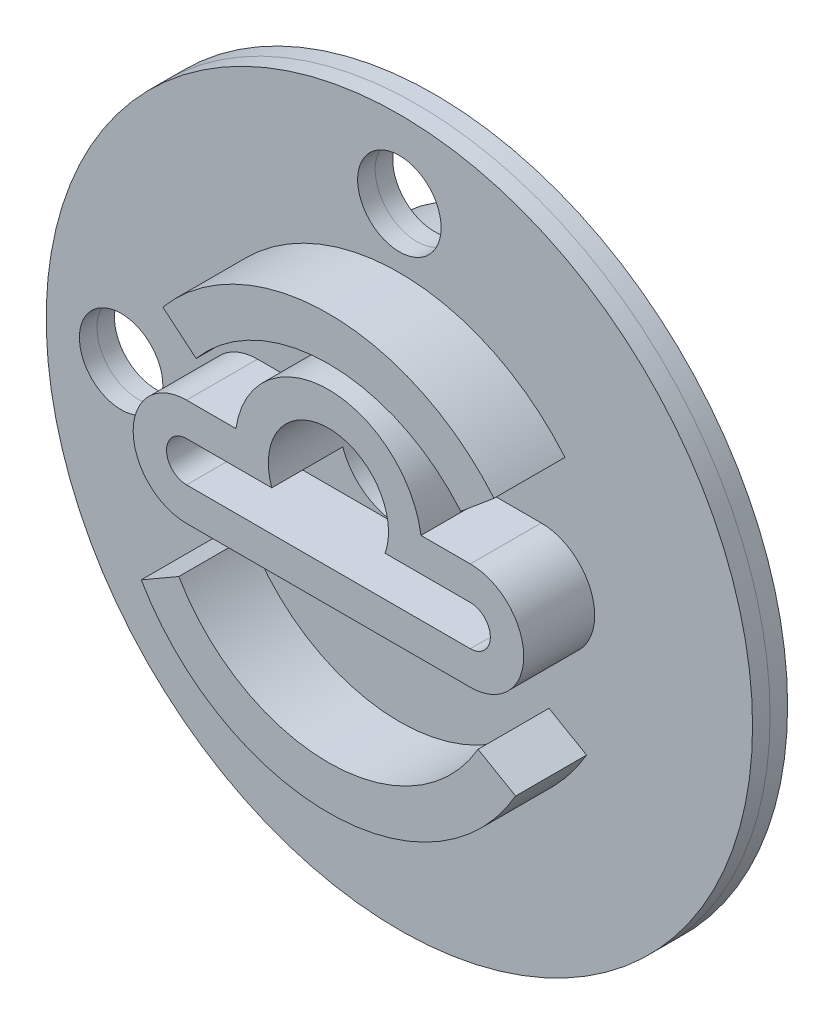
from build123d import *
from build123d.topology import SkipClean

# Parameters (mm, degrees)
SKETCH1_R               = 21.16
BOSS_EXTRUDE2_DEPTH     = 2.1
CUT_EXTRUDE1_DEPTH      = 30.998353288
CUT_EXTRUDE1_DEPTH_BACK = 30.998353288
SKETCH3_R               = 3.6
SKETCH6_R               = 4.85
SKETCH6_R_2             = 3.6
BOSS_EXTRUDE5_DEPTH     = 2.2
SKETCH7_R               = 11.25
SKETCH7_R_2             = 10
BOSS_EXTRUDE6_DEPTH     = 6
SPLIT1_SURFACE_1_BACK   = 61.395
SPLIT1_SURFACE_1_DEPTH  = 122.79
SPLIT1_SURFACE_2_BACK   = 61.395
SPLIT1_SURFACE_2_DEPTH  = 122.79
BOSS_EXTRUDE7_START     = 4.25
BOSS_EXTRUDE7_DEPTH     = 4.25
BOSS_EXTRUDE4_DEPTH     = 4.25
SKETCH10_R              = 2.5
CUT_EXTRUDE2_DEPTH      = 32.001632215


with BuildPart() as part:
    # Sketch1 → Boss-Extrude2 (new body)
    with BuildSketch(Plane.XY):
        Circle(SKETCH1_R)
    extrude(amount=BOSS_EXTRUDE2_DEPTH)

    # Sketch3 → Cut-Extrude1 (cut, two sides: drawn at the far end of the back side and taken through both)
    with BuildSketch(Plane.XY.offset(2.1).offset(-CUT_EXTRUDE1_DEPTH_BACK)):
        with Locations((0, 3.41)):
            Circle(SKETCH3_R)
    extrude(amount=CUT_EXTRUDE1_DEPTH + CUT_EXTRUDE1_DEPTH_BACK, mode=Mode.SUBTRACT)

    # Sketch6 → Boss-Extrude5 (add)
    with SkipClean():  # the faces are left unmerged after this step: merging them gives an invalid solid
        with BuildSketch(Plane(origin=(0, 0, 0), x_dir=(-1, 0, 0), z_dir=(0, 0, -1))):
            with Locations((0, 3.595)):
                Circle(SKETCH6_R)
            with Locations((0, 3.41)):
                Circle(SKETCH6_R_2, mode=Mode.SUBTRACT)
        extrude(amount=BOSS_EXTRUDE5_DEPTH)

    # Sketch7 → Boss-Extrude6 (add)
    with SkipClean():  # the faces are left unmerged after this step: merging them gives an invalid solid
        with BuildSketch(Plane(origin=(0, 0, 0), x_dir=(-1, 0, 0), z_dir=(0, 0, -1))):
            Circle(SKETCH7_R)
            Circle(SKETCH7_R_2, mode=Mode.SUBTRACT)
        extrude(amount=BOSS_EXTRUDE6_DEPTH)


with BuildPart() as body_2:
    # Split1: the piece behind the surface
    add(part.part)
    # Split1 surface: a surface, the sketch's curves swept straight by 122.79 mm
    with BuildLine(Plane(origin=(0, 0, 0), x_dir=(0, 0, -1), z_dir=(1, 0, 0)).offset(-SPLIT1_SURFACE_1_BACK), mode=Mode.PRIVATE) as split1_surface_1_path:
        Line((-1.05, 21.16), (-1.05, -21.16))
    split1_surface_1 = Shell.extrude(split1_surface_1_path.wire(), (1 * SPLIT1_SURFACE_1_DEPTH, 0 * SPLIT1_SURFACE_1_DEPTH, 0 * SPLIT1_SURFACE_1_DEPTH))
    split(bisect_by=split1_surface_1, keep=Keep.BOTTOM)

    # Sketch9 → Boss-Extrude7 (add)
    with BuildSketch(Plane.XY.offset(2.1).offset(BOSS_EXTRUDE7_START)):
        with BuildLine():
            Line((-8.5, -2.19), (8.5, -2.19))
            ThreePointArc((8.5, -2.19), (11.7, 1.01), (8.5, 4.21))
            Line((8.5, 4.21), (5.542562584, 4.21))
            ThreePointArc((5.542562584, 4.21), (0, 9.01), (-5.542562584, 4.21))
            Line((-5.542562584, 4.21), (-8.5, 4.21))
            ThreePointArc((-8.5, 4.21), (-11.7, 1.01), (-8.5, -2.19))
        make_face()
        with BuildLine():
            Line((-8.5, -0.19), (8.5, -0.19))
            ThreePointArc((8.5, -0.19), (9.7, 1.01), (8.5, 2.21))
            Line((8.5, 2.21), (3.39411255, 2.21))
            ThreePointArc((3.39411255, 2.21), (0, 7.01), (-3.39411255, 2.21))
            Line((-3.39411255, 2.21), (-8.5, 2.21))
            ThreePointArc((-8.5, 2.21), (-9.7, 1.01), (-8.5, -0.19))
        make_face(mode=Mode.SUBTRACT)
    extrude(amount=-BOSS_EXTRUDE7_DEPTH)

    # Sketch5 → Boss-Extrude4 (add)
    with BuildSketch(Plane.XY.offset(2.1)):
        with BuildLine():
            Line((7.928559986, 6.65285176), (9.920275538, 8.324099545))
            ThreePointArc((9.920275538, 8.324099545), (0, 12.95), (-9.920275538, 8.324099545))
            Line((-9.920275538, 8.324099545), (-7.928559986, 6.65285176))
            ThreePointArc((-7.928559986, 6.65285176), (0, 10.35), (7.928559986, 6.65285176))
        make_face()
        with BuildLine():
            Line((-8.963362929, -5.175), (-11.215028979, -6.475))
            ThreePointArc((-11.215028979, -6.475), (0, -12.95), (11.215028979, -6.475))
            Line((11.215028979, -6.475), (8.963362929, -5.175))
            ThreePointArc((8.963362929, -5.175), (0, -10.35), (-8.963362929, -5.175))
        make_face()
    extrude(amount=BOSS_EXTRUDE4_DEPTH)


with BuildPart() as part_1:
    add(part.part)

    # Split1: split by a surface, the side it looks to stays
    # Split1 surface: a surface, the sketch's curves swept straight by 122.79 mm
    with BuildLine(Plane(origin=(0, 0, 0), x_dir=(0, 0, -1), z_dir=(1, 0, 0)).offset(-SPLIT1_SURFACE_2_BACK), mode=Mode.PRIVATE) as split1_surface_2_path:
        Line((-1.05, 21.16), (-1.05, -21.16))
    split1_surface_2 = Shell.extrude(split1_surface_2_path.wire(), (1 * SPLIT1_SURFACE_2_DEPTH, 0 * SPLIT1_SURFACE_2_DEPTH, 0 * SPLIT1_SURFACE_2_DEPTH))
    split(bisect_by=split1_surface_2, keep=Keep.TOP)


with BuildPart() as cut_extrude2_tool:
    # Sketch10 → Cut-Extrude2 (new, through all)
    with SkipClean():  # the faces are left unmerged after this step: merging them gives an invalid solid
        with BuildSketch(Plane.XY.offset(2.1)):
            with Locations((0, 16.527610664)):
                Circle(SKETCH10_R)
            with Locations((-16.670494114, 0)):
                Circle(SKETCH10_R)
        extrude(amount=-CUT_EXTRUDE2_DEPTH)


with BuildPart() as part_2:
    with SkipClean():  # the faces are left unmerged after this step: merging them gives an invalid solid
        add(part_1.part)

        # Cut-Extrude2: cut by cut_extrude2_tool
        add(cut_extrude2_tool.part, mode=Mode.SUBTRACT)


with BuildPart() as body_2_1:
    with SkipClean():  # the faces are left unmerged after this step: merging them gives an invalid solid
        add(body_2.part)

        # Cut-Extrude2: cut by cut_extrude2_tool
        add(cut_extrude2_tool.part, mode=Mode.SUBTRACT)


solid = Compound([part_2.part, body_2_1.part])
